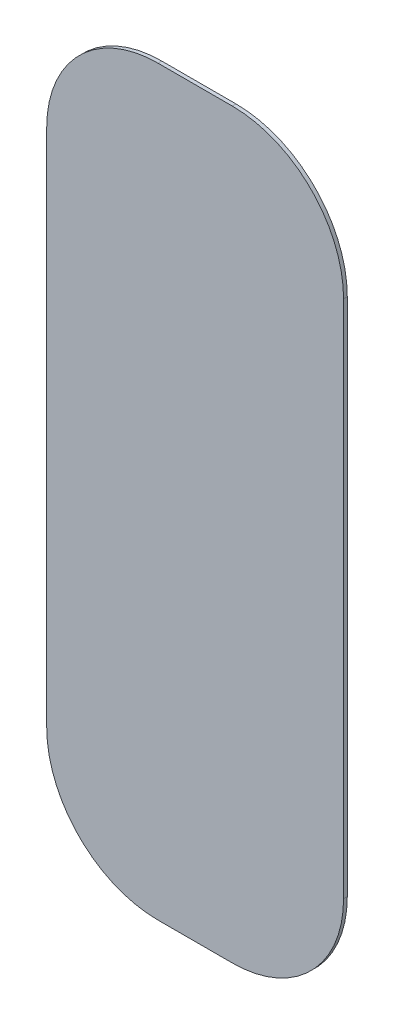
from build123d import *

# Parameters (mm, degrees)
EXTRUDE_1_DEPTH = 2


with BuildPart() as part:
    # Эскиз1 → Бобышка-Вытянуть1 (new body)
    with BuildSketch(Plane.XY):
        with BuildLine():
            Line((80, -140), (80, 140))
            ThreePointArc((80, 140), (62.426406871, 182.426406871), (20, 200))
            Line((20, 200), (-20, 200))
            ThreePointArc((-20, 200), (-62.426406871, 182.426406871), (-80, 140))
            Line((-80, 140), (-80, -140))
            ThreePointArc((-80, -140), (-62.426406871, -182.426406871), (-20, -200))
            Line((-20, -200), (20, -200))
            ThreePointArc((20, -200), (62.426406871, -182.426406871), (80, -140))
        make_face()
    extrude(amount=EXTRUDE_1_DEPTH)


solid = part.part
